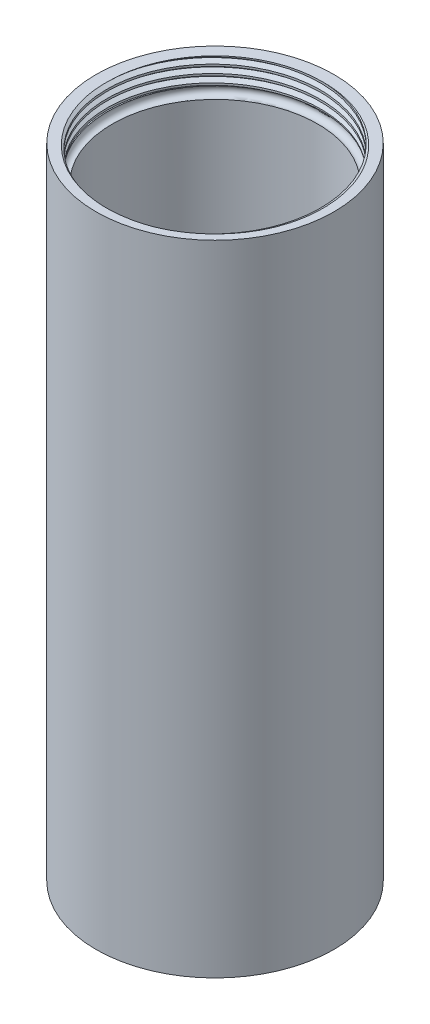
from build123d import *

# Parameters (mm, degrees)
ESBO_O1_R              = 36.5
ESBO_O1_R_2            = 31.5
CIL_NDRO_DEPTH         = 196
ESBO_O256_R            = 32.8
GRELHA_DEPTH           = 7
TUBEIRA_START          = -23.73
ESBO_O10_R             = 32.8
TUBEIRA_DEPTH          = 23.73
ROSCA_TUBEIRA_PITCH    = 2.5
ROSCA_TUBEIRA_TO       = 26.23
ANEL_TUBEIRA_PROFILE_R = 1.5
ESBO_O2_R              = 32.8
SUPORTE_DEPTH          = 8
ROSCA_SUPORTE_PITCH    = 2.5
ROSCA_SUPORTE_TO       = 10.5
ANEL_SUPORTE_PROFILE_R = 1.5


with BuildPart() as part:
    # Esboço1 → cilíndro (new body)
    with BuildSketch(Plane(origin=(0, 0, 0), x_dir=(1, 0, 0), z_dir=(0, 1, 0))):
        with Locations(Location((0, 0, 0), (0, 0, 270))):
            Circle(ESBO_O1_R)
        with Locations(Location((0, 0, 0), (0, 0, 270))):
            Circle(ESBO_O1_R_2, mode=Mode.SUBTRACT)
    extrude(amount=-CIL_NDRO_DEPTH)

    # Esboço256 → grelha (cut)
    with BuildSketch(Plane(origin=(0, -164, 0), x_dir=(-1, 0, 0), z_dir=(0, -1, 0))):
        with Locations(Location((0, 0, 0), (0, 0, 90))):
            Circle(ESBO_O256_R)
    extrude(amount=GRELHA_DEPTH, mode=Mode.SUBTRACT)

    # Esboço10 → tubeira (cut)
    with BuildSketch(Plane.XZ.offset(196).offset(TUBEIRA_START)):
        with Locations(Location((0, 0, 0), (0, 0, 270))):
            Circle(ESBO_O10_R)
    extrude(amount=TUBEIRA_DEPTH, mode=Mode.SUBTRACT)

    # rosca-tubeira: arcs per turn and ends read off the stored shape
    # rosca-tubeira: the profile of Perfil da rosca13 profile screwed along a right-hand helix through 10.492 turns, 10 arcs to a turn; built about Z, then put on its axis
    rosca_tubeira_z = Axis((0, 0, 0), (0, 0, 1))
    rosca_tubeira_corners = [(32.7997, 0, -0.000173205), (34.153164687, 0, 0.781249997), (34.153164687, 0, 1.093749997), (32.7997, 0, 1.875173198)]
    with BuildLine(mode=Mode.PRIVATE) as rosca_tubeira_profile:
        Line(rosca_tubeira_corners[0], rosca_tubeira_corners[1])
        Line(rosca_tubeira_corners[1], rosca_tubeira_corners[2])
        Line(rosca_tubeira_corners[2], rosca_tubeira_corners[3])
        Line(rosca_tubeira_corners[3], rosca_tubeira_corners[0])
    rosca_tubeira_cap = Face(rosca_tubeira_profile.wire())
    rosca_tubeira_turn_angles = [0, 18, 36, 54, 72, 90, 108, 126, 144, 162, 180, 198, 216, 234, 252, 270, 288, 306, 324, 342, 360]
    rosca_tubeira_turn_weights = [1, 0.9510565162951535, 1, 0.9510565162951535, 1, 0.9510565162951535, 1, 0.9510565162951535, 1, 0.9510565162951535, 1, 0.9510565162951535, 1, 0.9510565162951535, 1, 0.9510565162951535, 1, 0.9510565162951535, 1, 0.9510565162951535, 1]
    rosca_tubeira_turn_rails = [Edge.make_bspline([Vector(p[0], p[1], 0).rotate(rosca_tubeira_z, rosca_tubeira_turn_angles[k]) / rosca_tubeira_turn_weights[k] + Vector(0, 0, p[2] + ROSCA_TUBEIRA_PITCH * rosca_tubeira_turn_angles[k] / 360) for k in range(21)], [0, 0, 0, 1, 1, 2, 2, 3, 3, 4, 4, 5, 5, 6, 6, 7, 7, 8, 8, 9, 9, 10, 10, 10], 2, rosca_tubeira_turn_weights) for p in rosca_tubeira_corners]
    rosca_tubeira_turn_sides = [Face.make_surface_from_curves(rosca_tubeira_turn_rails[p[0]], rosca_tubeira_turn_rails[p[1]]) for p in [(0, 1), (1, 2), (2, 3), (3, 0)]]
    rosca_tubeira_last_angles = [3600, 3618, 3636, 3654, 3672, 3690, 3708, 3726, 3744, 3760.56, 3777.12]
    rosca_tubeira_last_weights = [1, 0.9510565162951535, 1, 0.9510565162951535, 1, 0.9510565162951535, 1, 0.9510565162951535, 1, 0.9585217890173762, 1]
    rosca_tubeira_last_rails = [Edge.make_bspline([Vector(p[0], p[1], 0).rotate(rosca_tubeira_z, rosca_tubeira_last_angles[k]) / rosca_tubeira_last_weights[k] + Vector(0, 0, p[2] + ROSCA_TUBEIRA_PITCH * rosca_tubeira_last_angles[k] / 360) for k in range(11)], [0, 0, 0, 1, 1, 2, 2, 3, 3, 4, 4, 5, 5, 5], 2, rosca_tubeira_last_weights) for p in rosca_tubeira_corners]
    rosca_tubeira_last_sides = [Face.make_surface_from_curves(rosca_tubeira_last_rails[p[0]], rosca_tubeira_last_rails[p[1]]) for p in [(0, 1), (1, 2), (2, 3), (3, 0)]]
    rosca_tubeira = Plane(origin=(0, -198.5, 0), x_dir=(1, 0, 0), z_dir=(0, 1, 0)) * split(Solid(Shell([*[p.moved(Location((0, 0, ROSCA_TUBEIRA_PITCH * i))) for i in range(10) for p in rosca_tubeira_turn_sides], *rosca_tubeira_last_sides, rosca_tubeira_cap, rosca_tubeira_cap.rotate(rosca_tubeira_z, 3777.12).moved(Location((0, 0, ROSCA_TUBEIRA_PITCH * 3777.12 / 360)))])), bisect_by=Plane.XY.offset(ROSCA_TUBEIRA_TO), keep=Keep.BOTTOM, mode=Mode.PRIVATE)
    add(rosca_tubeira, mode=Mode.SUBTRACT)

    # anel-tubeira: sweep along a path in Esboço191
    with BuildLine(Plane(origin=(0, -172.27, 0), x_dir=(-1, 0, 0), z_dir=(0, -1, 0))) as anel_tubeira_path:
        CenterArc((0, 0), 32.1, 0, 360)
    # anel-tubeira profile (on start of the path) → anel-tubeira (sweep, cut)
    with BuildSketch(Plane(origin=(-32.1, -172.27, 0), x_dir=(-1, 0, 0), z_dir=(0, 0, -1))):
        Circle(ANEL_TUBEIRA_PROFILE_R)
    sweep(path=anel_tubeira_path.line, mode=Mode.SUBTRACT)

    # Esboço2 → suporte (cut)
    with BuildSketch(Plane(origin=(0, 0, 0), x_dir=(1, 0, 0), z_dir=(0, 1, 0))):
        with Locations(Location((0, 0, 0), (0, 0, 90))):
            Circle(ESBO_O2_R)
    extrude(amount=-SUPORTE_DEPTH, mode=Mode.SUBTRACT)

    # rosca-suporte: arcs per turn and ends read off the stored shape
    # rosca-suporte: the profile of Perfil da rosca14 profile screwed along a right-hand helix through 4.2 turns, 10 arcs to a turn; built about Z, then put on its axis
    rosca_suporte_z = Axis((0, 0, 0), (0, 0, 1))
    rosca_suporte_corners = [(32.7997, 0, -0.000173205), (34.153164687, 0, 0.781249997), (34.153164687, 0, 1.093749997), (32.7997, 0, 1.875173198)]
    with BuildLine(mode=Mode.PRIVATE) as rosca_suporte_profile:
        Line(rosca_suporte_corners[0], rosca_suporte_corners[1])
        Line(rosca_suporte_corners[1], rosca_suporte_corners[2])
        Line(rosca_suporte_corners[2], rosca_suporte_corners[3])
        Line(rosca_suporte_corners[3], rosca_suporte_corners[0])
    rosca_suporte_cap = Face(rosca_suporte_profile.wire())
    rosca_suporte_turn_angles = [0, 18, 36, 54, 72, 90, 108, 126, 144, 162, 180, 198, 216, 234, 252, 270, 288, 306, 324, 342, 360]
    rosca_suporte_turn_weights = [1, 0.9510565162951535, 1, 0.9510565162951535, 1, 0.9510565162951535, 1, 0.9510565162951535, 1, 0.9510565162951535, 1, 0.9510565162951535, 1, 0.9510565162951535, 1, 0.9510565162951535, 1, 0.9510565162951535, 1, 0.9510565162951535, 1]
    rosca_suporte_turn_rails = [Edge.make_bspline([Vector(p[0], p[1], 0).rotate(rosca_suporte_z, rosca_suporte_turn_angles[k]) / rosca_suporte_turn_weights[k] + Vector(0, 0, p[2] + ROSCA_SUPORTE_PITCH * rosca_suporte_turn_angles[k] / 360) for k in range(21)], [0, 0, 0, 1, 1, 2, 2, 3, 3, 4, 4, 5, 5, 6, 6, 7, 7, 8, 8, 9, 9, 10, 10, 10], 2, rosca_suporte_turn_weights) for p in rosca_suporte_corners]
    rosca_suporte_turn_sides = [Face.make_surface_from_curves(rosca_suporte_turn_rails[p[0]], rosca_suporte_turn_rails[p[1]]) for p in [(0, 1), (1, 2), (2, 3), (3, 0)]]
    rosca_suporte_last_angles = [1440, 1458, 1476, 1494, 1512]
    rosca_suporte_last_weights = [1, 0.9510565162951535, 1, 0.9510565162951542, 1]
    rosca_suporte_last_rails = [Edge.make_bspline([Vector(p[0], p[1], 0).rotate(rosca_suporte_z, rosca_suporte_last_angles[k]) / rosca_suporte_last_weights[k] + Vector(0, 0, p[2] + ROSCA_SUPORTE_PITCH * rosca_suporte_last_angles[k] / 360) for k in range(5)], [0, 0, 0, 1, 1, 2, 2, 2], 2, rosca_suporte_last_weights) for p in rosca_suporte_corners]
    rosca_suporte_last_sides = [Face.make_surface_from_curves(rosca_suporte_last_rails[p[0]], rosca_suporte_last_rails[p[1]]) for p in [(0, 1), (1, 2), (2, 3), (3, 0)]]
    rosca_suporte = Plane(origin=(0, 2.5, 0), x_dir=(-1, 0, 0), z_dir=(0, -1, 0)) * split(Solid(Shell([*[p.moved(Location((0, 0, ROSCA_SUPORTE_PITCH * i))) for i in range(4) for p in rosca_suporte_turn_sides], *rosca_suporte_last_sides, rosca_suporte_cap, rosca_suporte_cap.rotate(rosca_suporte_z, 1512).moved(Location((0, 0, ROSCA_SUPORTE_PITCH * 1512 / 360)))])), bisect_by=Plane.XY.offset(ROSCA_SUPORTE_TO), keep=Keep.BOTTOM, mode=Mode.PRIVATE)
    add(rosca_suporte, mode=Mode.SUBTRACT)

    # anel-suporte: sweep along a path in Esboço187
    with BuildLine(Plane(origin=(0, -9.27, 0), x_dir=(1, 0, 0), z_dir=(0, 1, 0))) as anel_suporte_path:
        CenterArc((0, 0), 32.1, 0, 360)
    # anel-suporte profile (on start of the path) → anel-suporte (sweep, cut)
    with BuildSketch(Plane(origin=(32.1, -9.27, 0), x_dir=(-1, 0, 0), z_dir=(0, 0, -1))):
        Circle(ANEL_SUPORTE_PROFILE_R)
    sweep(path=anel_suporte_path.line, mode=Mode.SUBTRACT)


solid = part.part
